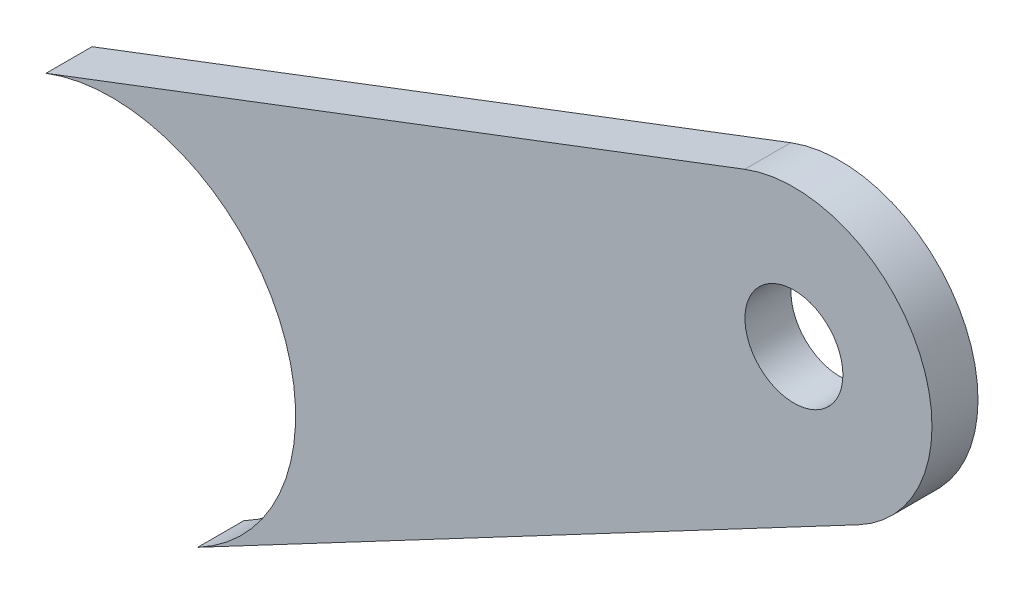
from build123d import *

# Parameters (mm, degrees)
SKETCH1_R           = 3.3782
BOSS_EXTRUDE1_DEPTH = 3.175


with BuildPart() as part:
    # Sketch1 → Boss-Extrude1 (new body)
    with BuildSketch(Plane.XY):
        with BuildLine():
            Line((-104.955845403, 8.900786167), (-153.165231265, -9.468104921))
            ThreePointArc((-153.165231265, -9.468104921), (-137.075815419, -16.093494691), (-142.700380036, -32.55950103))
            Line((-142.700380036, -32.55950103), (-97.107206981, -8.417760915))
            ThreePointArc((-97.107206981, -8.417760915), (-92.888783519, 3.931743839), (-104.955845403, 8.900786167))
        make_face()
        with Locations((-101.56444, 0)):
            Circle(SKETCH1_R, mode=Mode.SUBTRACT)
    extrude(amount=BOSS_EXTRUDE1_DEPTH)


solid = part.part
